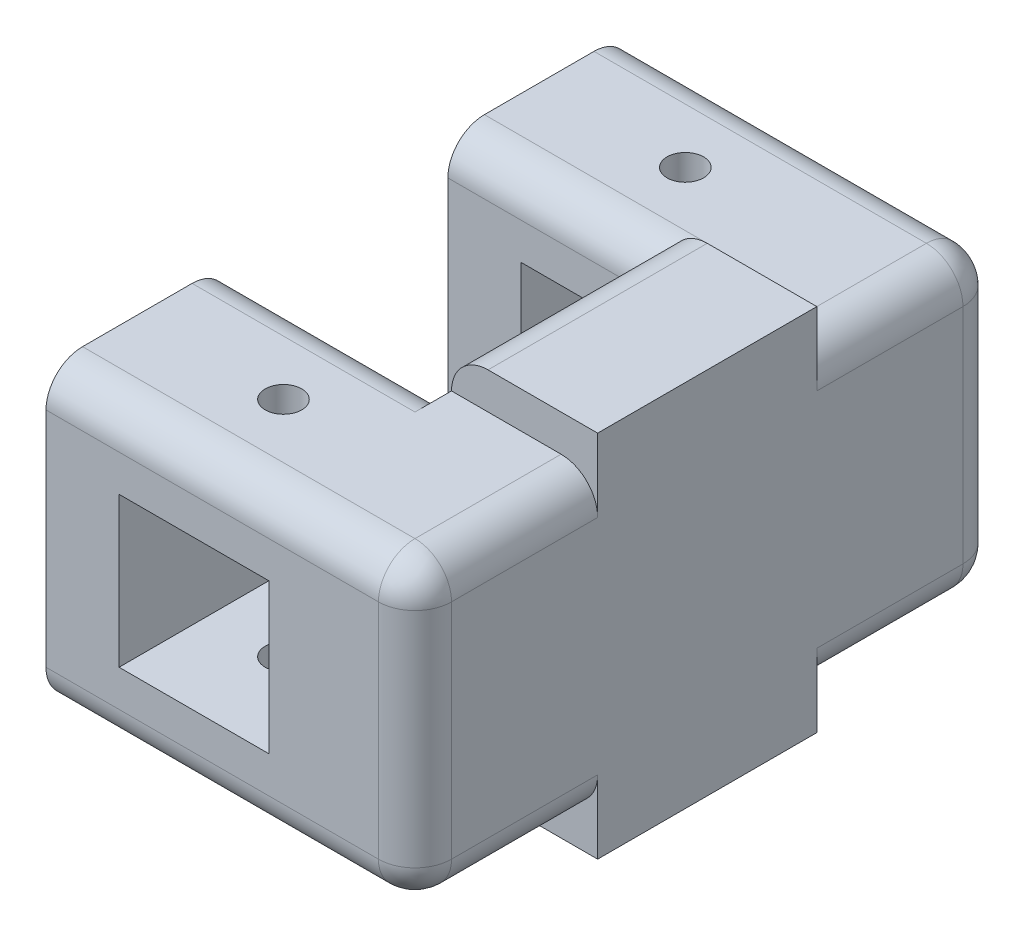
from build123d import *

# Parameters (mm, degrees)
SKETCH2_W           = 50.5
SKETCH2_H           = 40.5
SKETCH2_W_2         = 20.5
SKETCH2_H_2         = 20.5
BOSS_EXTRUDE3_DEPTH = 25
BOSS_EXTRUDE5_DEPTH = 30
SKETCH6_W           = 50.5
SKETCH6_H           = 40.5
SKETCH6_W_2         = 20.5
SKETCH6_H_2         = 20.5
BOSS_EXTRUDE6_DEPTH = 25
FILLET6_R           = 5
FILLET8_R           = 5
FILLET10_R          = 5
HOLE1_OUTLINE_R     = 2.5
HOLE1_DEPTH         = 40.5
HOLE2_OUTLINE_R     = 2.5
HOLE2_DEPTH         = 40.5
FILLET11_R          = 5


# Read off the part's stored shape, not the designer's step: Hole1, Hole2
with BuildPart() as part:
    # Sketch2 → Boss-Extrude3 (new body)
    with BuildSketch(Plane.XY):
        with Locations((25.25, 20.25)):
            Rectangle(SKETCH2_W, SKETCH2_H)
        with Locations((20.25, 20.25)):
            Rectangle(SKETCH2_W_2, SKETCH2_H_2, mode=Mode.SUBTRACT)
    extrude(amount=BOSS_EXTRUDE3_DEPTH)

    # Sketch5 → Boss-Extrude5 (add)
    with BuildSketch(Plane.XY.offset(25)):
        Polygon((50.5, 40.5), (50.5, 0), (50.5, -5), (30.5, -5), (30.5, 0), (30.5, 5), (35.5, 5), (35.5, 35.5), (30.5, 35.5), (30.5, 40.5), (30.5, 45.5), (50.5, 45.5), align=None)
    extrude(amount=BOSS_EXTRUDE5_DEPTH)

    # Sketch6 → Boss-Extrude6 (add)
    with BuildSketch(Plane.XY.offset(55)):
        with Locations((25.25, 20.25)):
            Rectangle(SKETCH6_W, SKETCH6_H)
        with Locations((20.25, 20.25)):
            Rectangle(SKETCH6_W_2, SKETCH6_H_2, mode=Mode.SUBTRACT)
    extrude(amount=BOSS_EXTRUDE6_DEPTH)

    # Fillet6
    fillet6_edges = [part.edges().sort_by_distance(p)[0] for p in [
        (50.5, 0, 67.5),
        (50.5, 40.5, 67.5),
        (50.5, 40.5, 12.5),
        (50.5, 0, 12.5),
    ]]
    fillet(fillet6_edges, radius=FILLET6_R)

    # Fillet8
    fillet8_edges = [part.edges().sort_by_distance(p)[0] for p in [
        (22.75, 0, 0),
        (22.75, 0, 80),
        (50.5, 20.25, 0),
        (50.5, 20.25, 80),
        (22.75, 40.5, 80),
        (49.035533906, 39.035533906, 80),
        (49.035533906, 1.464466094, 80),
        (22.75, 40.5, 0),
        (49.035533906, 39.035533906, 0),
        (49.035533906, 1.464466094, 0),
    ]]
    fillet(fillet8_edges, radius=FILLET8_R)

    # Fillet10
    # the kernel refuses this fillet: 5 mm, written as the material it takes off along each edge
    with BuildSketch(Plane(origin=(-12.5, 0, 25), x_dir=(0, 0, -1), z_dir=(1, 0, 0)), Plane(origin=(-12.5, 0, 55), x_dir=(0, 1, 0), z_dir=(1, 0, 0)), Plane(origin=(30.5, 40.5, 55), x_dir=(0, -1, 0), z_dir=(-1, 0, 0))) as fillet10_piece_1:
        with BuildLine():
            CenterArc((FILLET10_R, FILLET10_R), FILLET10_R, 180, 90)
            Line((0, FILLET10_R), (0, 0))
            Line((0, 0), (FILLET10_R, 0))
        make_face()
    extrude(amount=43, mode=Mode.SUBTRACT)
    with BuildSketch(Plane(origin=(30.5, 40.5, 25), x_dir=(0, -1, 0), z_dir=(-1, 0, 0))) as fillet10_piece_2:
        with BuildLine():
            CenterArc((FILLET10_R, -FILLET10_R), FILLET10_R, 90, 90)
            Line((0, -FILLET10_R), (0, 0))
            Line((0, 0), (FILLET10_R, 0))
        make_face()
    extrude(amount=43, mode=Mode.SUBTRACT)

    # Hole1 outline → Hole1 (cut)
    with BuildSketch(Plane(origin=(0, 0, 0), x_dir=(1, 0, 0), z_dir=(0, 1, 0))):
        with Locations((20, -67.5)):
            Circle(HOLE1_OUTLINE_R)
    extrude(amount=HOLE1_DEPTH, mode=Mode.SUBTRACT)

    # Hole2 outline → Hole2 (cut)
    with BuildSketch(Plane(origin=(0, 0, 0), x_dir=(1, 0, 0), z_dir=(0, 1, 0))):
        with Locations((20, -12.5)):
            Circle(HOLE2_OUTLINE_R)
    extrude(amount=HOLE2_DEPTH, mode=Mode.SUBTRACT)

    # Fillet11
    fillet11_edges = [part.edges().sort_by_distance(p)[0] for p in [
        (30.5, -5, 40),
        (30.5, 45.5, 40),
    ]]
    fillet(fillet11_edges, radius=FILLET11_R)


solid = part.part
